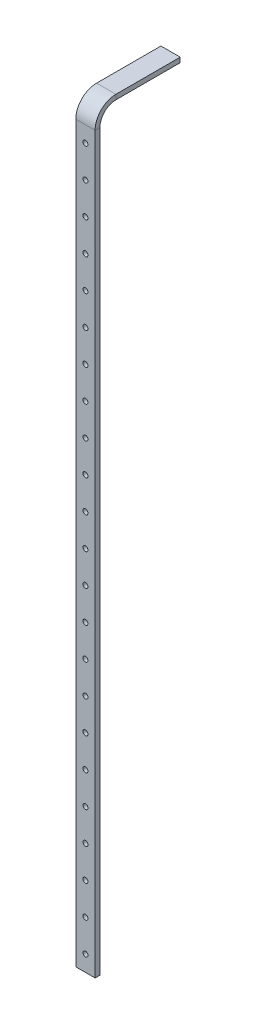
from build123d import *

# Parameters (mm, degrees)
SKETCH1_W                   = 12.7
SKETCH1_H                   = 483
BOSS_EXTRUDE1_DEPTH         = 3.175
EDGE_FLANGE1_DEPTH          = 12.7
TAP_DRILL_FOR_M4X0_7_TAP1_D = 3.3


# Sheet-metal steps are written as plain solids
with BuildPart() as part:
    # Sketch1 → Boss-Extrude1 (new body)
    with BuildSketch(Plane.XY):
        with Locations((6.35, 241.5)):
            Rectangle(SKETCH1_W, SKETCH1_H)
    extrude(amount=BOSS_EXTRUDE1_DEPTH)

    # Edge-Flange1 section (across the edge) → Edge-Flange1 (add)
    with BuildSketch(Plane(origin=(0, 493.5, 0), x_dir=(0, -1, 0), z_dir=(1, 0, 0))):
        with BuildLine():
            Line((-3.175, 10.5), (-3.175, 52.825))
            Line((-3.175, 52.825), (0, 52.825))
            Line((0, 52.825), (0, 10.5))
            ThreePointArc((0, 10.5), (3.075378798, 3.075378798), (10.5, 0))
            Line((10.5, 0), (10.5, -3.175))
            ThreePointArc((10.5, -3.175), (0.830314767, 0.830314767), (-3.175, 10.5))
        make_face()
    extrude(amount=EDGE_FLANGE1_DEPTH)

    # Tap Drill for M4x0.7 Tap1 (through all)
    with Locations(Plane.XY.offset(3.175)):
        with Locations((6.35, 10.5), (6.35, 31.5), (6.35, 52.5), (6.35, 73.5), (6.35, 94.5), (6.35, 115.5), (6.35, 136.5), (6.35, 157.5), (6.35, 178.5), (6.35, 199.5), (6.35, 220.5), (6.35, 241.5), (6.35, 262.5), (6.35, 283.5), (6.35, 304.5), (6.35, 325.5), (6.35, 346.5), (6.35, 367.5), (6.35, 388.5), (6.35, 409.5), (6.35, 430.5), (6.35, 451.5), (6.35, 472.5)):
            Hole(TAP_DRILL_FOR_M4X0_7_TAP1_D / 2)


solid = part.part
